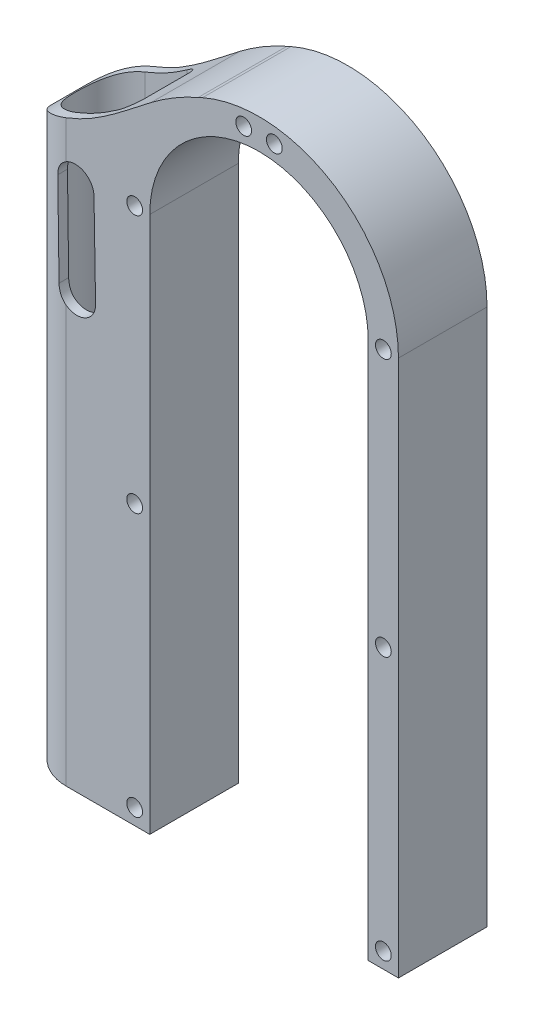
from build123d import *

# Parameters (mm, degrees)
BOSS_EXTRUDE1_DEPTH = 19.05
SKETCH2_R           = 1.7
CUT_EXTRUDE1_DEPTH  = 302.810637772
CUT_EXTRUDE2_DEPTH  = 302.810637772
BOSS_EXTRUDE2_DEPTH = 135
BOSS_EXTRUDE3_START = -19.05
BOSS_EXTRUDE3_DEPTH = 19.05
CUT_EXTRUDE4_DEPTH  = 316.043777756
CUT_EXTRUDE5_DEPTH  = 249.524391307
CUT_EXTRUDE6_DEPTH  = 7
FILLET1_R           = 50
FILLET2_R           = 10
FILLET3_R           = 3


with BuildPart() as part:
    # Sketch1 → Boss-Extrude1 (new body)
    with BuildSketch(Plane.XY):
        with BuildLine():
            Line((-179.085368151, -18.789194183), (-179.085368151, 212.188334746))
            ThreePointArc((-179.085368151, 212.188334746), (-149.085368151, 242.188334746), (-119.085368151, 212.188334746))
            Line((-119.085368151, 212.188334746), (-119.085368151, -18.789194183))
            ThreePointArc((-119.085368151, -18.789194183), (-149.085368151, -48.789194183), (-179.085368151, -18.789194183))
        make_face()
        with BuildLine():
            Line((-172.585368151, -18.789194183), (-172.585368151, 212.188334746))
            ThreePointArc((-172.585368151, 212.188334746), (-149.085368151, 235.688334746), (-125.585368151, 212.188334746))
            Line((-125.585368151, 212.188334746), (-125.585368151, -18.789194183))
            ThreePointArc((-125.585368151, -18.789194183), (-149.085368151, -42.289194183), (-172.585368151, -18.789194183))
        make_face(mode=Mode.SUBTRACT)
    extrude(amount=BOSS_EXTRUDE1_DEPTH)

    # Sketch2 → Cut-Extrude1 (cut, through all)
    with BuildSketch(Plane.XY.offset(19.05)):
        with Locations((-145.785368151, 238.734002942)):
            Circle(SKETCH2_R)
        with Locations((-122.335368151, 212.188334746)):
            Circle(SKETCH2_R)
        with Locations((-152.485368151, -45.322239617)):
            Circle(SKETCH2_R)
        with Locations((-168.000474547, -37.70430058)):
            Circle(SKETCH2_R)
        with Locations((-175.835368151, -18.789194183)):
            Circle(SKETCH2_R)
        with Locations((-175.835368151, 212.188334746)):
            Circle(SKETCH2_R)
        with Locations((-145.685368151, -45.322239617)):
            Circle(SKETCH2_R)
        with Locations((-175.835368151, 100.099570281)):
            Circle(SKETCH2_R)
        with Locations((-175.835368151, 93.299570281)):
            Circle(SKETCH2_R)
        with Locations((-122.335368151, 100.099570281)):
            Circle(SKETCH2_R)
        with Locations((-122.335368151, 93.299570281)):
            Circle(SKETCH2_R)
        with Locations((-122.335368151, -18.789194183)):
            Circle(SKETCH2_R)
        with Locations((-130.170261754, -37.70430058)):
            Circle(SKETCH2_R)
        with Locations((-175.835368151, 156.699570281)):
            Circle(SKETCH2_R)
        with Locations((-122.335368151, 156.699570281)):
            Circle(SKETCH2_R)
        with Locations((-175.835368151, 66.699570281)):
            Circle(SKETCH2_R)
        with Locations((-122.335368151, 66.699570281)):
            Circle(SKETCH2_R)
        with Locations((-175.835368151, 36.699570281)):
            Circle(SKETCH2_R)
        with Locations((-122.335368151, 36.699570281)):
            Circle(SKETCH2_R)
        with Locations((-175.835368151, 6.699570281)):
            Circle(SKETCH2_R)
        with Locations((-122.335368151, 6.699570281)):
            Circle(SKETCH2_R)
        with Locations((-152.385368151, 238.734002942)):
            Circle(SKETCH2_R)
    extrude(amount=-CUT_EXTRUDE1_DEPTH, mode=Mode.SUBTRACT)

    # Sketch3 → Cut-Extrude2 (cut, through all)
    with BuildSketch(Plane.XY.offset(19.05)):
        Polygon((-149.085368151, 96.699570281), (-100.167336626, 96.699570281), (-100.167336626, -59.171887956), (-212.527814826, -59.171887956), (-212.527814826, 96.699570281), align=None)
    extrude(amount=-CUT_EXTRUDE2_DEPTH, mode=Mode.SUBTRACT)

    # Sketch4 → Boss-Extrude2 (add)
    with BuildSketch(Plane.XZ.offset(-96.699570281)):
        with BuildLine():
            Line((-179.085368151, 19.05), (-196.652205402, 19.05))
            ThreePointArc((-196.652205402, 19.05), (-200.585368151, 9.525), (-196.652205402, 0))
            Line((-196.652205402, 0), (-179.085368151, 0))
            Line((-179.085368151, 0), (-179.085368151, 19.05))
        make_face()
    extrude(amount=-BOSS_EXTRUDE2_DEPTH)

    # Sketch5 → Boss-Extrude3 (add)
    with BuildSketch(Plane.XY.offset(19.05).offset(BOSS_EXTRUDE3_START)):
        with BuildLine():
            Line((-179.085368151, 231.699570281), (-179.085368151, 212.188334746))
            ThreePointArc((-179.085368151, 212.188334746), (-174.234371945, 228.544605963), (-161.250194275, 239.611263206))
            Line((-161.250194275, 239.611263206), (-179.085368151, 231.699570281))
        make_face()
    extrude(amount=BOSS_EXTRUDE3_DEPTH)

    # Sketch6 → Cut-Extrude4 (cut, through all)
    with BuildSketch(Plane.XY.offset(19.05)):
        with BuildLine():
            Line((-166.948269283, 237.083594004), (-200.585368151, 237.083594004))
            Line((-200.585368151, 237.083594004), (-200.585368151, 215.169829532))
            add(Edge.make_bspline(
                [(-166.948269283, 237.083594004), (-174.08025285, 232.264666523), (-185.619403498, 221.256742546), (-196.521569709, 219.674382376), (-200.585368151, 215.169829532)],
                knots=[0, 0, 0, 0, 0.58548773, 1, 1, 1, 1], degree=3))
        make_face()
    extrude(amount=-CUT_EXTRUDE4_DEPTH, mode=Mode.SUBTRACT)

    # Sketch7 → Cut-Extrude5 (cut, through all)
    with BuildSketch(Plane.XZ.offset(-96.699570281)):
        with BuildLine():
            Line((-190.585368151, 17.025), (-178.585368151, 17.025))
            Line((-178.585368151, 17.025), (-178.585368151, 2.025))
            Line((-178.585368151, 2.025), (-190.585368151, 2.025))
            ThreePointArc((-190.585368151, 2.025), (-198.085368151, 9.525), (-190.585368151, 17.025))
        make_face()
    extrude(amount=-CUT_EXTRUDE5_DEPTH, mode=Mode.SUBTRACT)

    # Sketch8 → Cut-Extrude6 (cut)
    with BuildSketch(Plane.XY.offset(19.05)):
        with BuildLine():
            Line((-184.578582607, 209.622626451), (-184.241218911, 189.62547201))
            ThreePointArc((-184.241218911, 189.62547201), (-188.17317706, 185.558568382), (-192.240080687, 189.490526531))
            Line((-192.240080687, 189.490526531), (-192.577444383, 209.487680972))
            ThreePointArc((-192.577444383, 209.487680972), (-188.645486234, 213.554584599), (-184.578582607, 209.622626451))
        make_face()
    extrude(amount=-CUT_EXTRUDE6_DEPTH, mode=Mode.SUBTRACT)

    # Fillet1
    fillet1_edges = [part.edges().sort_by_distance(p)[0] for p in [
        (-166.948269283, 237.083594004, 9.525),
    ]]
    fillet(fillet1_edges, radius=FILLET1_R)

    # Fillet2
    # the kernel refuses this fillet: 10 mm, written as the material it takes off along each edge
    with BuildSketch(Plane(origin=(-196.652205402, 66.752998532, 0), x_dir=(1, 0, 0), z_dir=(0, 1, 0))) as fillet2_piece_1:
        with BuildLine():
            CenterArc((6.099219193, -10), FILLET2_R, 90, 97.799925588)
            ThreePointArc((-3.808260974, -11.357142857), (-3.23274377, -5.233062714), (0, 0))
            Line((0, 0), (6.099219193, 0))
        make_face()
    extrude(amount=181.626081549, mode=Mode.SUBTRACT)
    with BuildSketch(Plane(origin=(-196.652205402, 66.752998532, 19.05), x_dir=(-0.3179212804444137, 0, -0.9481171127242586), z_dir=(0, 1, 0))) as fillet2_piece_2:
        with BuildLine():
            CenterArc((7.542099552, -8.961986896), FILLET2_R, 63.66281519, 97.799925588)
            Line((-1.939071576, -5.782774091), (0, 0))
            ThreePointArc((0, 0), (5.98931435, 1.401317691), (11.9786287, 0))
        make_face()
    extrude(amount=181.626081549, mode=Mode.SUBTRACT)

    # Fillet3
    fillet3_edges = [part.edges().sort_by_distance(p)[0] for p in [
        (-178.585368151, 162.512316203, 17.025),
        (-178.585368151, 162.512316203, 2.025),
    ]]
    fillet(fillet3_edges, radius=FILLET3_R)


solid = part.part
